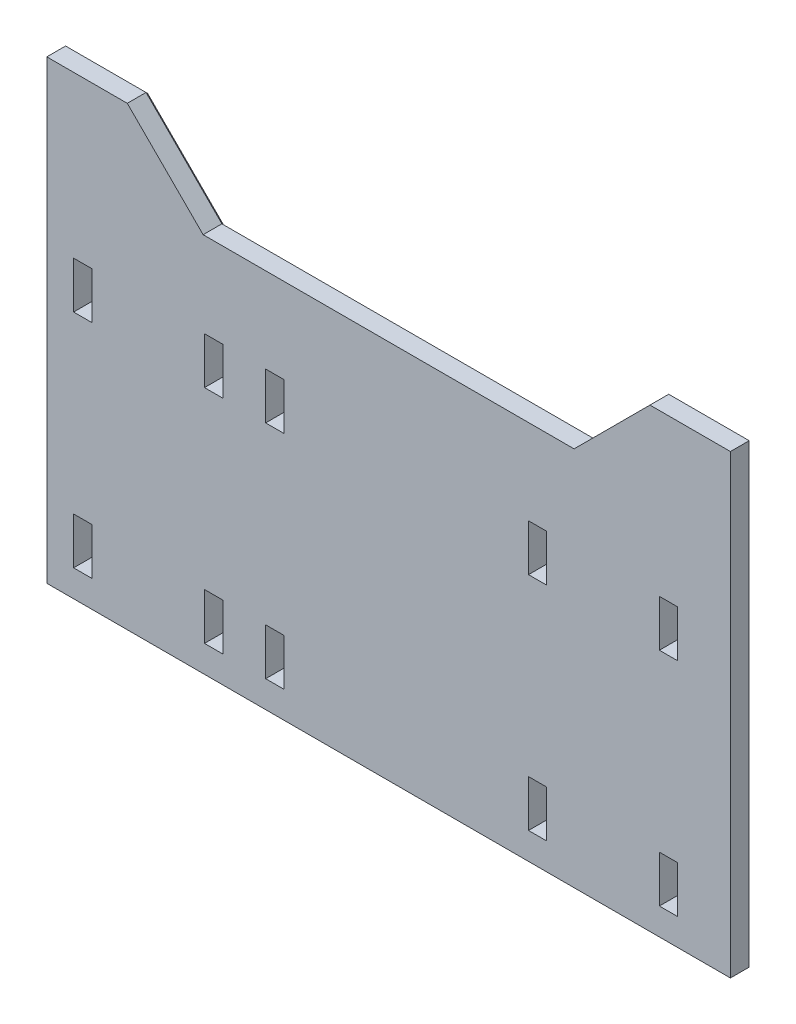
from build123d import *

# Parameters (mm, degrees)
SKETCH1_W           = 127.440194606
SKETCH1_H           = 60
SKETCH1_W_2         = 3.4
SKETCH1_H_2         = 8.7
BOSS_EXTRUDE1_DEPTH = 4
BOSS_EXTRUDE2_DEPTH = 4
CHAMFER1_SIZE       = 0.5


with BuildPart() as part:
    # Sketch1 → Boss-Extrude1 (new body)
    with BuildSketch(Plane.XY):
        Rectangle(SKETCH1_W, SKETCH1_H)
        with Locations((-32.620097303, 20.65)):
            Rectangle(SKETCH1_W_2, SKETCH1_H_2, mode=Mode.SUBTRACT)
        with Locations((27.7799027, 20.65)):
            Rectangle(SKETCH1_W_2, SKETCH1_H_2, mode=Mode.SUBTRACT)
        with Locations((27.7799027, -20.65)):
            Rectangle(SKETCH1_W_2, SKETCH1_H_2, mode=Mode.SUBTRACT)
        with Locations((-21.220097303, 20.65)):
            Rectangle(SKETCH1_W_2, SKETCH1_H_2, mode=Mode.SUBTRACT)
        with Locations((-21.220097303, -20.65)):
            Rectangle(SKETCH1_W_2, SKETCH1_H_2, mode=Mode.SUBTRACT)
        with Locations((52.1799027, 20.65)):
            Rectangle(SKETCH1_W_2, SKETCH1_H_2, mode=Mode.SUBTRACT)
        with Locations((52.1799027, -20.65)):
            Rectangle(SKETCH1_W_2, SKETCH1_H_2, mode=Mode.SUBTRACT)
        with Locations((-32.620097303, -20.65)):
            Rectangle(SKETCH1_W_2, SKETCH1_H_2, mode=Mode.SUBTRACT)
        with Locations((-57.020097303, 20.65)):
            Rectangle(SKETCH1_W_2, SKETCH1_H_2, mode=Mode.SUBTRACT)
        with Locations((-57.020097303, -20.65)):
            Rectangle(SKETCH1_W_2, SKETCH1_H_2, mode=Mode.SUBTRACT)
    extrude(amount=-BOSS_EXTRUDE1_DEPTH)

    # Sketch2 → Boss-Extrude2 (add)
    with BuildSketch(Plane.XY):
        Polygon((-63.720097303, 30), (-63.720097303, 55), (-48.720097303, 55), (-34.577961679, 40.857864376), (34.577961679, 40.857864376), (48.720097303, 55), (63.720097303, 55), (63.720097303, 30), align=None)
    extrude(amount=-BOSS_EXTRUDE2_DEPTH)

    # Chamfer1
    chamfer1_edges = [part.edges().sort_by_distance(p)[0] for p in [
        (56.220097303, 55, -4),
        (41.649029491, 47.928932188, -4),
        (0, 40.857864376, -4),
        (-41.649029491, 47.928932188, -4),
        (-56.220097303, 55, -4),
        (-63.720097303, 12.5, -4),
        (0, -30, -4),
        (63.720097303, 12.5, -4),
        (29.4799027, 20.65, -4),
        (27.7799027, 16.3, -4),
        (26.0799027, 20.65, -4),
        (27.7799027, 25, -4),
        (29.4799027, -20.65, -4),
        (27.7799027, -25, -4),
        (26.0799027, -20.65, -4),
        (27.7799027, -16.3, -4),
        (-22.920097303, 20.65, -4),
        (-21.220097303, 25, -4),
        (-19.520097303, 20.65, -4),
        (-21.220097303, 16.3, -4),
        (-22.920097303, -20.65, -4),
        (-21.220097303, -16.3, -4),
        (-19.520097303, -20.65, -4),
        (-21.220097303, -25, -4),
        (-30.920097303, 20.65, -4),
        (-32.620097303, 16.3, -4),
        (-34.320097303, 20.65, -4),
        (-32.620097303, 25, -4),
        (-30.920097303, -20.65, -4),
        (-32.620097303, -25, -4),
        (-34.320097303, -20.65, -4),
        (-32.620097303, -16.3, -4),
        (53.8799027, 20.65, -4),
        (52.1799027, 16.3, -4),
        (50.4799027, 20.65, -4),
        (52.1799027, 25, -4),
        (53.8799027, -20.65, -4),
        (52.1799027, -25, -4),
        (50.4799027, -20.65, -4),
        (52.1799027, -16.3, -4),
        (-55.320097303, 20.65, -4),
        (-57.020097303, 16.3, -4),
        (-58.720097303, 20.65, -4),
        (-57.020097303, 25, -4),
        (-55.320097303, -20.65, -4),
        (-57.020097303, -25, -4),
        (-58.720097303, -20.65, -4),
        (-57.020097303, -16.3, -4),
    ]]
    chamfer(chamfer1_edges, length=CHAMFER1_SIZE)


solid = part.part
